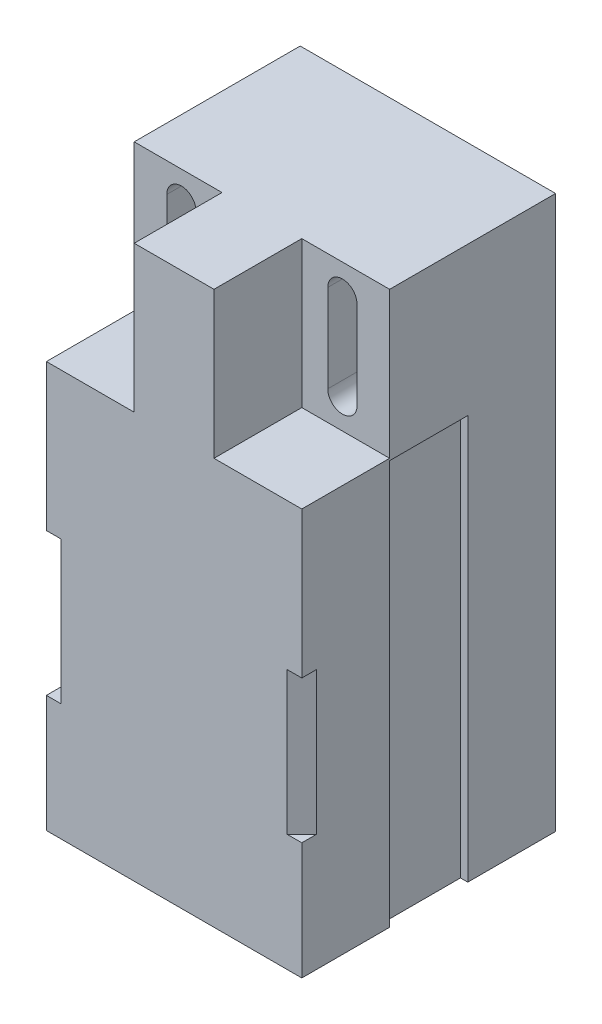
from build123d import *

# Parameters (mm, degrees)
SKETCH1_W                      = 17.45
SKETCH1_H                      = 37.75
PROFILEBOSS_EXTRUDE1_DEPTH     = 17.34
TOPINDENTSSKETCH2_W            = 6
TOPINDENTSSKETCH2_H            = 10
TOPINDENTCUT_EXTRUDE1_DEPTH    = 6
MOUNTSLOTCUTCUT_EXTRUDE2_DEPTH = 44.106386998
FRONTEDGECHAMFER1_START        = 8
FRONTEDGECHAMFER1_DEPTH        = 9.75
RIGHTSLOTSKETCH4_W             = 5.34
RIGHTSLOTSKETCH4_H             = 27.610084113
RIGHTSLOTCUT_EXTRUDE5_DEPTH    = 0.5
LEFTSLOTSKETCH5_W              = 5.34
LEFTSLOTSKETCH5_H              = 27.50506845
CUT_EXTRUDE8_DEPTH             = 0.5


with BuildPart() as part:
    # Sketch1 → ProfileBoss-Extrude1 (new body)
    with BuildSketch(Plane.XY):
        with Locations((8.725, 18.875)):
            Rectangle(SKETCH1_W, SKETCH1_H)
    extrude(amount=PROFILEBOSS_EXTRUDE1_DEPTH)

    # TopIndentsSketch2 → TopIndentCut-Extrude1 (cut)
    with BuildSketch(Plane.XY.offset(17.34)):
        with Locations((14.45, 32.75)):
            Rectangle(TOPINDENTSSKETCH2_W, TOPINDENTSSKETCH2_H)
        with Locations((3, 32.75)):
            Rectangle(TOPINDENTSSKETCH2_W, TOPINDENTSSKETCH2_H)
    extrude(amount=-TOPINDENTCUT_EXTRUDE1_DEPTH, mode=Mode.SUBTRACT)

    # Sketch3 → MountSlotCutCut-Extrude2 (cut, through all)
    with BuildSketch(Plane.XY.offset(11.34)):
        with BuildLine():
            Line((13.225, 29.75), (13.225, 35.75))
            ThreePointArc((13.225, 35.75), (14.225, 36.75), (15.225, 35.75))
            Line((15.225, 35.75), (15.225, 29.75))
            ThreePointArc((15.225, 29.75), (14.225, 28.75), (13.225, 29.75))
        make_face()
        with BuildLine():
            Line((2.225, 29.75), (2.225, 35.75))
            ThreePointArc((2.225, 35.75), (3.225, 36.75), (4.225, 35.75))
            Line((4.225, 35.75), (4.225, 29.75))
            ThreePointArc((4.225, 29.75), (3.225, 28.75), (2.225, 29.75))
        make_face()
    extrude(amount=-MOUNTSLOTCUTCUT_EXTRUDE2_DEPTH, mode=Mode.SUBTRACT)

    # FrontEdgeChamfer1: read off the stored shape, not the designer's step
    # FrontEdgeChamfer1 outline → FrontEdgeChamfer1 (cut)
    with BuildSketch(Plane(origin=(0, 0, 0), x_dir=(1, 0, 0), z_dir=(0, 1, 0)).offset(FRONTEDGECHAMFER1_START)):
        Polygon((17.45, -17.34), (17.45, -16.34), (16.45, -17.34), align=None)
        Polygon((0, -17.34), (1, -17.34), (0, -16.34), align=None)
    extrude(amount=FRONTEDGECHAMFER1_DEPTH, mode=Mode.SUBTRACT)

    # RightSlotSketch4 → RightSlotCut-Extrude5 (cut)
    with BuildSketch(Plane(origin=(17.45, 0, 0), x_dir=(0, 0, -1), z_dir=(1, 0, 0))):
        with Locations((-8.67, 13.805042057)):
            Rectangle(RIGHTSLOTSKETCH4_W, RIGHTSLOTSKETCH4_H)
    extrude(amount=-RIGHTSLOTCUT_EXTRUDE5_DEPTH, mode=Mode.SUBTRACT)

    # LeftSlotSketch5 → Cut-Extrude8 (cut)
    with BuildSketch(Plane.ZY):
        with Locations((8.67, 13.752534225)):
            Rectangle(LEFTSLOTSKETCH5_W, LEFTSLOTSKETCH5_H)
    extrude(amount=-CUT_EXTRUDE8_DEPTH, mode=Mode.SUBTRACT)


solid = part.part
